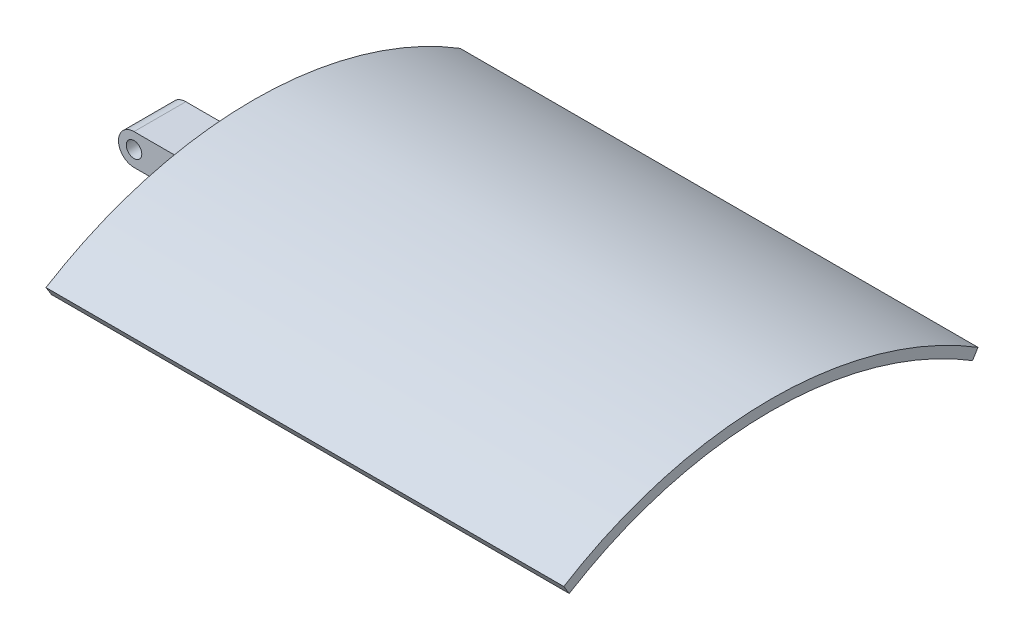
from build123d import *

# Parameters (mm, degrees)
BOSS_EXTRU_1_DEPTH      = 100
BOSS_EXTRU_2_DEPTH      = 3
BOSS_EXTRU_2_DEPTH_BACK = 3
D_GAGEMENT_M31_D        = 3.4
D_GAGEMENT_M31_DEPTH    = 8.5
D_GAGEMENT_M31_TIP      = 1.021463052
BOSS_EXTRU_3_DEPTH      = 5
BOSS_EXTRU_3_DEPTH_BACK = 5
ESQUISSE7_R             = 1.5


with BuildPart() as part:
    # Esquisse1 → Boss.-Extru.1 (new body)
    with BuildSketch(Plane(origin=(0, 0, 0), x_dir=(0, 0, -1), z_dir=(1, 0, 0))):
        with BuildLine():
            Line((-40, 64.857073631), (-38.950131234, 63.154788234))
            ThreePointArc((-38.950131234, 63.154788234), (0, 74.2), (38.950131234, 63.154788234))
            Line((38.950131234, 63.154788234), (40, 64.857073631))
            ThreePointArc((40, 64.857073631), (0, 76.2), (-40, 64.857073631))
        make_face()
    extrude(amount=BOSS_EXTRU_1_DEPTH)

    # Esquisse3 → Boss.-Extru.2 (add, two sides: drawn at the far end of the back side and taken through both)
    with BuildSketch(Plane.XY.offset(-BOSS_EXTRU_2_DEPTH_BACK)):
        with BuildLine():
            Line((60, 74.2), (60, 69.2))
            ThreePointArc((60, 69.2), (63, 66.2), (66, 69.2))
            Line((66, 69.2), (66, 74.2))
            Line((66, 74.2), (60, 74.2))
        make_face()
    extrude(amount=BOSS_EXTRU_2_DEPTH + BOSS_EXTRU_2_DEPTH_BACK)

    # Dégagement M31
    with Locations(Plane.XY.offset(3)):
        with Locations((63, 69.2)):
            Hole(D_GAGEMENT_M31_D / 2, depth=D_GAGEMENT_M31_DEPTH)
            with Locations((0, 0, -(D_GAGEMENT_M31_DEPTH + D_GAGEMENT_M31_TIP / 2))):  # 118° drill point
                Cone(0, D_GAGEMENT_M31_D / 2, D_GAGEMENT_M31_TIP, mode=Mode.SUBTRACT)

    # Esquisse7 → Boss.-Extru.3 (add, two sides: drawn at the far end of the back side and taken through both)
    with BuildSketch(Plane.XY.offset(-BOSS_EXTRU_3_DEPTH_BACK)):
        with BuildLine():
            Line((7, 74.2), (7, 73.544291939))
            Line((7, 73.544291939), (-6.331051255, 64.43935692))
            Line((-6.331051255, 64.43935692), (-18, 64.43935692))
            ThreePointArc((-18, 64.43935692), (-21, 61.43935692), (-18, 58.43935692))
            Line((-18, 58.43935692), (-4.539014482, 58.43935692))
            Line((-4.539014482, 58.43935692), (13, 70.418276219))
            Line((13, 70.418276219), (13, 74.2))
            Line((13, 74.2), (7, 74.2))
        make_face()
        with Locations((-18, 61.43935692)):
            Circle(ESQUISSE7_R, mode=Mode.SUBTRACT)
    extrude(amount=BOSS_EXTRU_3_DEPTH + BOSS_EXTRU_3_DEPTH_BACK)


solid = part.part
